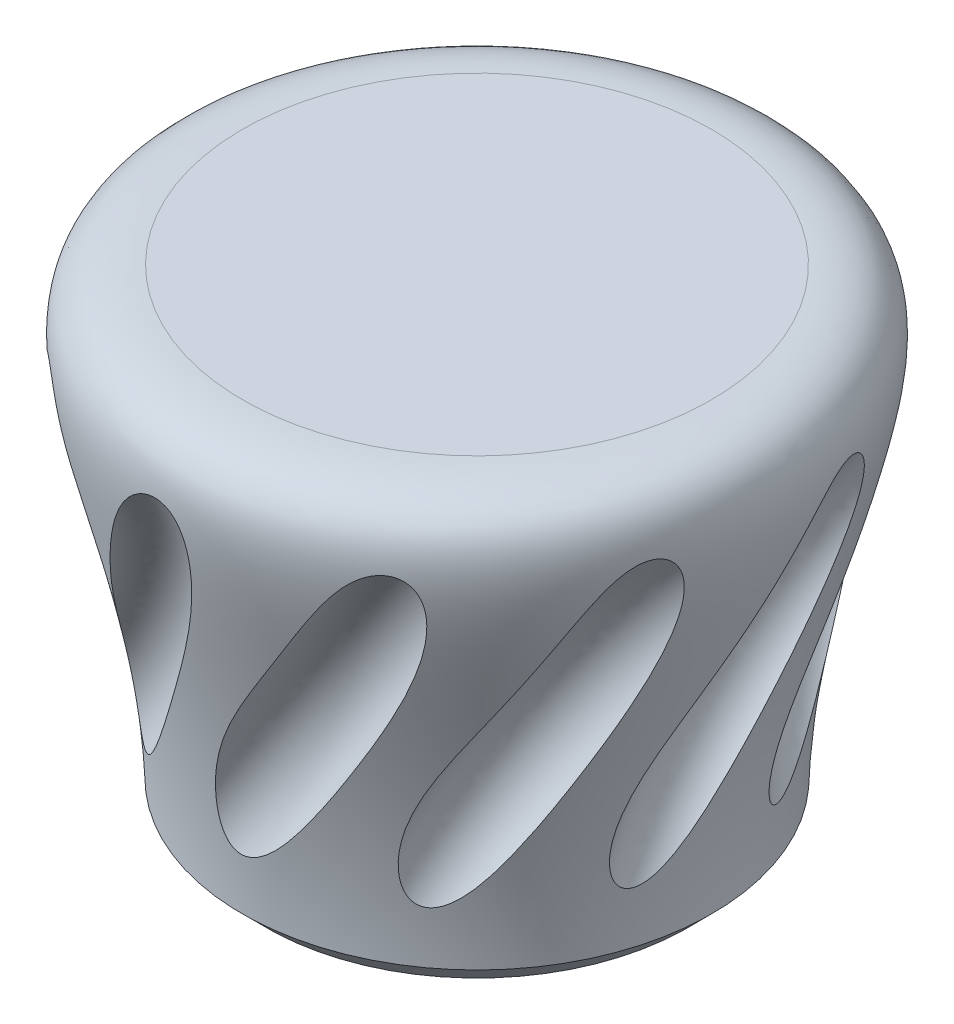
from build123d import *
from build123d.topology import SkipClean

# Parameters (mm, degrees)
SKETCH2_R           = 3.08
CUT_EXTRUDE1_DEPTH  = 13.4
SKETCH6_R           = 2
CIRPATTERN1_COUNT   = 10
CHAMFER2_SIZE       = 1
BOSS_EXTRUDE1_REACH = 24.731


with BuildPart() as part:
    # Sketch1 → Revolve1 (revolve)
    with BuildSketch(Plane.XY):
        with BuildLine():
            Line((0, 0), (10, 0))
            add(Edge.make_bspline(
                [(10, 20), (16.713627483, 20), (10, 11.812014469), (10, 0)],
                knots=[0, 0, 0, 0, 1, 1, 1, 1], degree=3))
            Line((10, 20), (0, 20))
            Line((0, 20), (0, 0))
        make_face()
    revolve(axis=Axis((0, 0, 0), (0, 1, 0)))

    # Chamfer1: read off the stored shape, not the designer's step
    # Chamfer1 outline → Chamfer1 (revolve, cut)
    with BuildSketch(Plane.XY):
        Polygon((10.016382855, 1.016382855), (9, 0), (10.016382855, 0), align=None)
    revolve(axis=Axis((0, 0, 0), (0, 1, 0)), mode=Mode.SUBTRACT)

    # Sketch2 → Cut-Extrude1 (cut)
    with BuildSketch(Plane.XZ):
        with Locations(Location((0, 0, 0), (0, 0, 270))):
            Circle(SKETCH2_R)
    extrude(amount=-CUT_EXTRUDE1_DEPTH, mode=Mode.SUBTRACT)

    # Cut-Sweep1: sweep along a path in Sketch5
    with BuildLine(Plane(origin=(0, 2.647058824, -4.411764706), x_dir=(1, 0, 0), z_dir=(0, -0.5144957554275266, 0.8574929257125442))) as cut_sweep1_path:
        CenterArc((-36.263689711, 4.511713382), 25, 0, 360)
    # Sketch6 → Cut-Sweep1 (sweep, cut)
    with BuildSketch(Plane(origin=(0, -2.647058824, -1.588235294), x_dir=(1, 0, 0), z_dir=(0, -0.8574929257125443, -0.5144957554275265))):
        with Locations((-12.446470268, -5.144957554)):
            Circle(SKETCH6_R)
    cut_sweep1 = sweep(path=cut_sweep1_path.line, mode=Mode.SUBTRACT)

    # CirPattern1: Cut-Sweep1 ×10 about axis
    cirpattern1_axis = Axis((0, 0, 0), (0, -1, 0))
    for i in range(1, CIRPATTERN1_COUNT):
        add(cut_sweep1.rotate(cirpattern1_axis, i * 360 / CIRPATTERN1_COUNT), mode=Mode.SUBTRACT)

    # Chamfer2
    chamfer2_edges = [part.edges().sort_by_distance(p)[0] for p in [
        (0, 0, 3.08),
    ]]
    chamfer(chamfer2_edges, length=CHAMFER2_SIZE)

    # Boss-Extrude1: up to this cone (the profile starts outside it)
    with SkipClean():  # the faces are left unmerged after this step: merging them gives an invalid solid
        boss_extrude1_end = Plane(origin=(0, 13.4, 0), z_dir=(0, -1, 0)).offset(9.320001) * Cone(1e-06, 15.911, 15.910999, align=(Align.CENTER, Align.CENTER, Align.MIN), mode=Mode.PRIVATE)
        # Sketch8 → Boss-Extrude1 (add, up to the surface)
        with BuildSketch(Plane.XZ.offset(-13.4), mode=Mode.PRIVATE) as boss_extrude1_sk1:
            with BuildLine():
                Line((-1.9, 2.424128709), (1.9, 2.424128709))
                ThreePointArc((1.9, 2.424128709), (0, 3.08), (-1.9, 2.424128709))
            make_face()
        boss_extrude1_tool1 = extrude(boss_extrude1_sk1.sketch, amount=BOSS_EXTRUDE1_REACH, mode=Mode.PRIVATE) - boss_extrude1_end
        add(boss_extrude1_tool1.solids().sort_by_distance((0, 13.4, 2.689029))[0])


solid = part.part
